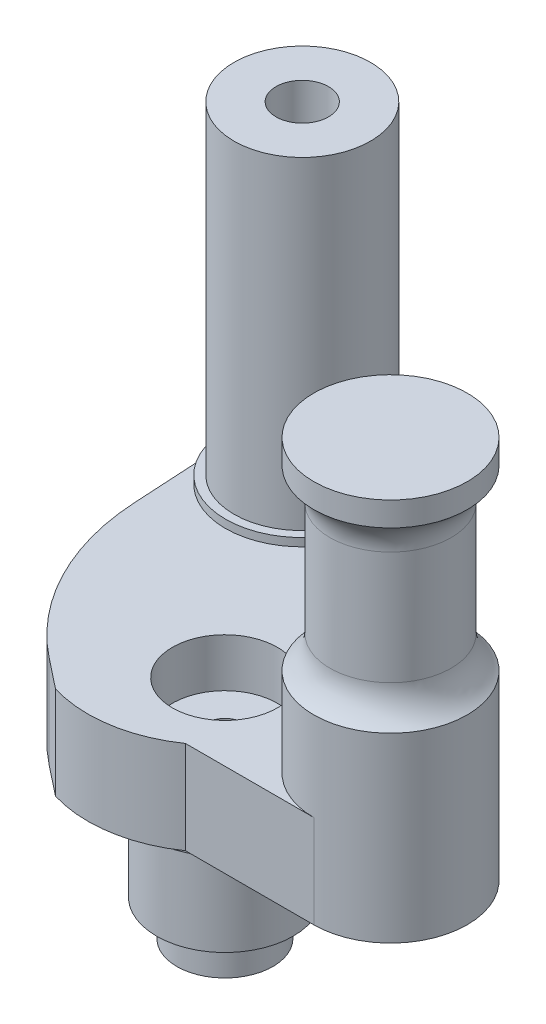
from build123d import *

# Parameters (mm, degrees)
SKETCH_1_R           = 5.95
EXTRUDE_1_DEPTH      = 4.5
SKETCH_4_R           = 8.45
EXTRUDE_4_DEPTH      = 17.75
EXTRUDE_6_DEPTH      = 5.75
EXTRUDE_6_DEPTH_BACK = 5.75
SKETCH_12_R          = 9.5
EXTRUDE_10_DEPTH     = 1
SKETCH_7_R           = 2.3
CUT_EXTRUDE_1_DEPTH  = 57.22806055
SKETCH_8_R           = 6.5
CUT_EXTRUDE_2_DEPTH  = 6
SKETCH_9_R           = 9.5
EXTRUDE_7_DEPTH      = 36
SKETCH_10_R          = 8.45
EXTRUDE_8_DEPTH      = 40
EXTRUDE_START        = 1
SKETCH_13_R          = 9.5
SKETCH_13_R_2        = 2.3
EXTRUDE_11_DEPTH     = 1
SKETCH_14_R          = 3.25
CUT_EXTRUDE_3_DEPTH  = 8
CUT_EXTRUDE_START    = -18
CUT_EXTRUDE_4_DEPTH  = 18
CUT_EXTRUDE_START_2  = 11
SKETCH_16_R          = 14.956390748
SKETCH_16_R_2        = 7.5
CUT_EXTRUDE_5_DEPTH  = 22
FILLET_2_R           = 5
SKETCH_17_R          = 7.5
EXTRUDE_12_DEPTH     = 11.5


with BuildPart() as part:
    # Эскиз1 → Бобышка-Вытянуть1 (new body)
    with BuildSketch(Plane(origin=(0, 0, 0), x_dir=(1, 0, 0), z_dir=(0, 1, 0))):
        with Locations(Location((0, 0, 0), (0, 0, 270))):
            Circle(SKETCH_1_R)
    extrude(amount=EXTRUDE_1_DEPTH)

    # Эскиз4 → Бобышка-Вытянуть4 (add)
    with BuildSketch(Plane(origin=(0, 4.5, 0), x_dir=(1, 0, 0), z_dir=(0, 1, 0))):
        with Locations(Location((0, 0, 0), (0, 0, 270))):
            Circle(SKETCH_4_R)
    extrude(amount=EXTRUDE_4_DEPTH)

    # Эскиз6 → Бобышка-Вытянуть6 (add, two sides: drawn at the far end of the back side and taken through both)
    with BuildSketch(Plane(origin=(0, 22.25, 0), x_dir=(1, 0, 0), z_dir=(0, 1, 0)).offset(-EXTRUDE_6_DEPTH_BACK)):
        with BuildLine():
            Line((0, -9.5), (-0.833655922, -9.5))
            ThreePointArc((-0.833655922, -9.5), (-3.331132848, -9.18310947), (-5.670324417, -8.252521801))
            ThreePointArc((-5.670324417, -8.252521801), (-13.556905273, -2.05094269), (-19.066851837, 6.333461279))
            Line((-19.066851837, 6.333461279), (-28.114764095, 31.1923959))
            Line((-28.114764095, 31.1923959), (-10.2606043, 37.690778624))
            Line((-10.2606043, 37.690778624), (-2.394850826, 16.079798567))
            ThreePointArc((-2.394850826, 16.079798567), (1.266311019, 11.308479557), (7.002075382, 9.5))
            Line((7.002075382, 9.5), (30, 9.5))
            Line((30, 9.5), (30, -9.5))
            Line((30, -9.5), (0, -9.5))
        make_face()
    extrude(amount=EXTRUDE_6_DEPTH + EXTRUDE_6_DEPTH_BACK)

    # Эскиз12 → Бобышка-Вытянуть10 (add)
    with BuildSketch(Plane(origin=(0, 28, 0), x_dir=(1, 0, 0), z_dir=(0, 1, 0))):
        with Locations(Location((-15.938492836, 25.514507365, 0), (0, 0, 110))):
            Circle(SKETCH_12_R)
    extrude(amount=EXTRUDE_10_DEPTH)

    # Эскиз7 → Вырез-Вытянуть1 (cut, through all)
    with BuildSketch(Plane.XZ):
        with Locations(Location((0, 0, 0), (0, 0, 270))):
            Circle(SKETCH_7_R)
    extrude(amount=-CUT_EXTRUDE_1_DEPTH, mode=Mode.SUBTRACT)

    # Эскиз8 → Вырез-Вытянуть2 (cut)
    with BuildSketch(Plane(origin=(0, 28, 0), x_dir=(1, 0, 0), z_dir=(0, 1, 0))):
        with Locations(Location((0, 0, 0), (0, 0, 270))):
            Circle(SKETCH_8_R)
    extrude(amount=-CUT_EXTRUDE_2_DEPTH, mode=Mode.SUBTRACT)

    # Эскиз9 → Бобышка-Вытянуть7 (add)
    with BuildSketch(Plane.XZ.offset(-28)):
        with Locations(Location((20.5, 0, 0), (0, 0, 90))):
            Circle(SKETCH_9_R)
    extrude(amount=-EXTRUDE_7_DEPTH)

    # Эскиз10 → Бобышка-Вытянуть8 (add)
    with BuildSketch(Plane(origin=(0, 29, 0), x_dir=(1, 0, 0), z_dir=(0, 1, 0))):
        with Locations(Location((-15.938492836, 25.514507365, 0), (0, 0, 270))):
            Circle(SKETCH_10_R)
    extrude(amount=EXTRUDE_8_DEPTH)

    # Эскиз13 → Бобышка-Вытянуть11 (add)
    with BuildSketch(Plane.XZ.offset(-16.5).offset(EXTRUDE_START)):
        with Locations(Location((0, 0, 0), (0, 0, 90))):
            Circle(SKETCH_13_R)
        with Locations(Location((0, 0, 0), (0, 0, 270))):
            Circle(SKETCH_13_R_2, mode=Mode.SUBTRACT)
    extrude(amount=-EXTRUDE_11_DEPTH)

    # Эскиз14 → Вырез-Вытянуть3 (cut)
    with BuildSketch(Plane(origin=(0, 69, 0), x_dir=(1, 0, 0), z_dir=(0, 1, 0))):
        with Locations(Location((-15.938492836, 25.514507365, 0), (0, 0, 270))):
            Circle(SKETCH_14_R)
    extrude(amount=-CUT_EXTRUDE_3_DEPTH, mode=Mode.SUBTRACT)

    # Эскиз15 → Вырез-Вытянуть4 (cut)
    with BuildSketch(Plane(origin=(0, 28, 0), x_dir=(1, 0, 0), z_dir=(0, 1, 0)).offset(CUT_EXTRUDE_START)):
        with BuildLine():
            Line((-24.865572733, 22.265316003), (-35.336248809, 21.155444764))
            Line((-35.336248809, 21.155444764), (-35.336248809, 37.040132254))
            Line((-35.336248809, 37.040132254), (1.913807819, 42.427920993))
            Line((1.913807819, 42.427920993), (-7.011412938, 28.763698726))
            ThreePointArc((-7.011412938, 28.763698726), (-19.187684197, 34.441587262), (-24.865572733, 22.265316003))
        make_face()
        with BuildLine():
            Line((20.5, 9.5), (21.51421168, 16.603692208))
            Line((21.51421168, 16.603692208), (46.391879719, 13.051846104))
            Line((46.391879719, 13.051846104), (43.436938274, -14.794111134))
            Line((43.436938274, -14.794111134), (20.5, -14.236753678))
            Line((20.5, -14.236753678), (20.5, -9.5))
            ThreePointArc((20.5, -9.5), (30, 0), (20.5, 9.5))
        make_face()
    extrude(amount=CUT_EXTRUDE_4_DEPTH, mode=Mode.SUBTRACT)

    # Эскиз16 → Вырез-Вытянуть5 (cut)
    with BuildSketch(Plane(origin=(0, 28, 0), x_dir=(1, 0, 0), z_dir=(0, 1, 0)).offset(CUT_EXTRUDE_START_2)):
        with Locations((20.5, 0)):
            Circle(SKETCH_16_R)
        with Locations(Location((20.5, 0, 0), (0, 0, 270))):
            Circle(SKETCH_16_R_2, mode=Mode.SUBTRACT)
    extrude(amount=CUT_EXTRUDE_5_DEPTH, mode=Mode.SUBTRACT)

    # Скругление2
    # the kernel refuses this fillet: 5 mm, written as the material it adds along each edge
    with BuildSketch(Plane(origin=(20.5, 39, 0), x_dir=(0, 0, 1), z_dir=(-1, 0, 0))) as fillet_2_piece_1:
        with BuildLine():
            CenterArc((12.5, 4), FILLET_2_R, 180, 53.130102354)
            Line((7.5, 4), (7.4, 4))
            Line((7.4, 4), (7.4, 0))
            Line((7.4, 0), (7.5, -0.1))
            ThreePointArc((7.5, -0.1), (8.5, -0.1), (9.44, -0.08))
            Line((9.44, -0.08), (9.5, 0))
        make_face()
    revolve(axis=Axis((20.5, 39, 0), (0, 1, 0)))
    with BuildSketch(Plane(origin=(20.5, 61, 0), x_dir=(0, 0, 1), z_dir=(-1, 0, 0))) as fillet_2_piece_2:
        with BuildLine():
            CenterArc((12.5, -4), FILLET_2_R, 126.869897646, 53.130102354)
            Line((9.5, 0), (9.44, 0.08))
            ThreePointArc((9.44, 0.08), (8.5, 0.1), (7.5, 0.1))
            Line((7.5, 0.1), (7.4, 0))
            Line((7.4, 0), (7.4, -4))
            Line((7.4, -4), (7.5, -4))
        make_face()
    revolve(axis=Axis((20.5, 61, 0), (0, 1, 0)))

    # Эскиз17 → Бобышка-Вытянуть12 (add)
    with BuildSketch(Plane(origin=(0, 28, 0), x_dir=(1, 0, 0), z_dir=(0, 1, 0))):
        with BuildLine():
            Line((-9.278482036, -11.69085434), (-12.972576627, -8.775389277))
            ThreePointArc((-12.972576627, -8.775389277), (-20.997261978, 0.921608959), (-24.337711873, 13.057042378))
            Line((-24.337711873, 13.057042378), (-24.865572733, 22.265316003))
            Line((-24.865572733, 22.265316003), (-5.413533881, 23.476451416))
            Line((-5.413533881, 23.476451416), (9.371872764, 11.807465836))
            ThreePointArc((9.371872764, 11.807465836), (8.040562687, -6.286337643), (-9.278482036, -11.69085434))
        make_face()
        Circle(SKETCH_17_R, mode=Mode.SUBTRACT)
    extrude(amount=-EXTRUDE_12_DEPTH)


solid = part.part
